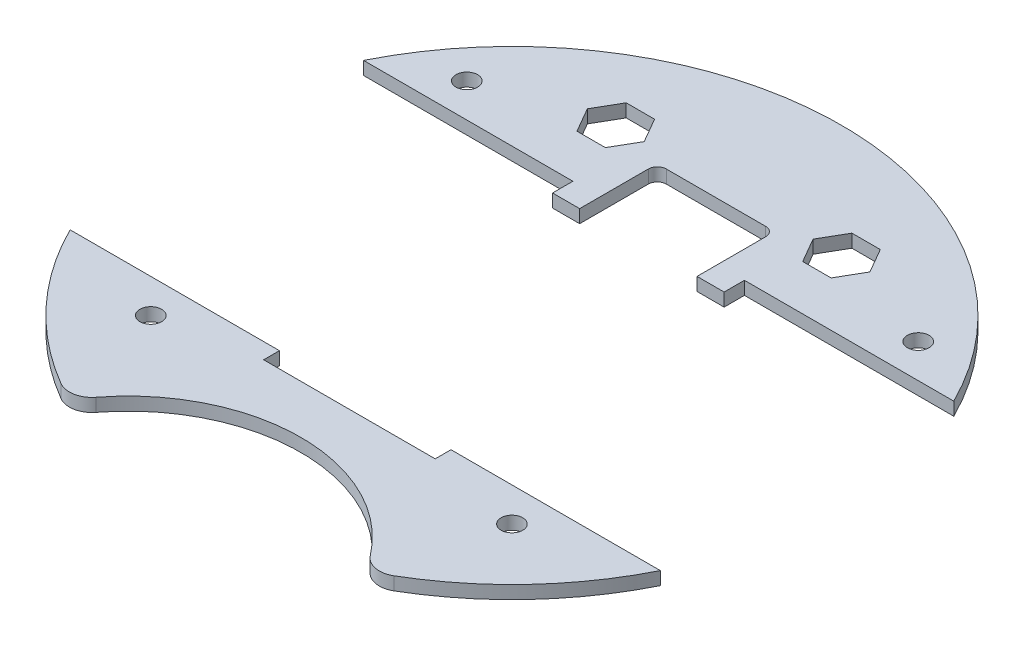
from build123d import *

# Parameters (mm, degrees)
BOSS_EXTRUDE1_DEPTH  = 2.9
SOLENOID_PLACEMENT_W = 38
SOLENOID_PLACEMENT_H = 64
CUT_EXTRUDE1_DEPTH   = 104.278313309
CUT_EXTRUDE4_DEPTH   = 104.278313309
CUT_EXTRUDE5_DEPTH   = 104.278313309
SKETCH6_R            = 2.4
CUT_EXTRUDE6_DEPTH   = 104.278313309
CUT_EXTRUDE3_DEPTH   = 104.278313309


with BuildPart() as part:
    # Sketch1 → Boss-Extrude1 (new body)
    with BuildSketch(Plane(origin=(0, 0, 0), x_dir=(1, 0, 0), z_dir=(0, 1, 0))):
        with BuildLine():
            ThreePointArc((36.856602833, -63.012624351), (0, 73), (-36.856602833, -63.012624351))
            ThreePointArc((-36.856602833, -63.012624351), (-33.368752207, -63.602994345), (-30.363140064, -61.737536127))
            ThreePointArc((-30.363140064, -61.737536127), (0, -46.75), (30.363140064, -61.737536127))
            ThreePointArc((30.363140064, -61.737536127), (33.368752207, -63.602994345), (36.856602833, -63.012624351))
        make_face()
    extrude(amount=BOSS_EXTRUDE1_DEPTH)

    # solenoid placement → Cut-Extrude1 (cut, through all)
    with BuildSketch(Plane(origin=(0, 2.9, 0), x_dir=(1, 0, 0), z_dir=(0, 1, 0))):
        with Locations((0, -4)):
            Rectangle(SOLENOID_PLACEMENT_W, SOLENOID_PLACEMENT_H)
    extrude(amount=-CUT_EXTRUDE1_DEPTH, mode=Mode.SUBTRACT)

    # Sketch4 → Cut-Extrude4 (cut, through all)
    with BuildSketch(Plane(origin=(0, 2.9, 0), x_dir=(1, 0, 0), z_dir=(0, 1, 0))):
        with BuildLine():
            Line((-13, 28), (13, 28))
            Line((13, 28), (13, 43.2))
            ThreePointArc((13, 43.2), (12.414213562, 44.614213562), (11, 45.2))
            Line((11, 45.2), (-11, 45.2))
            ThreePointArc((-11, 45.2), (-12.414213562, 44.614213562), (-13, 43.2))
            Line((-13, 43.2), (-13, 28))
        make_face()
    extrude(amount=-CUT_EXTRUDE4_DEPTH, mode=Mode.SUBTRACT)

    # Sketch5 → Cut-Extrude5 (cut, through all)
    with BuildSketch(Plane(origin=(0, 2.9, 0), x_dir=(1, 0, 0), z_dir=(0, 1, 0))):
        Polygon((-18.706882066, 48), (-21.853441033, 53.45), (-28.146558967, 53.45), (-31.293117934, 48), (-28.146558967, 42.55), (-21.853441033, 42.55), align=None)
        Polygon((18.706882066, 48), (21.853441033, 42.55), (28.146558967, 42.55), (31.293117934, 48), (28.146558967, 53.45), (21.853441033, 53.45), align=None)
    extrude(amount=-CUT_EXTRUDE5_DEPTH, mode=Mode.SUBTRACT)

    # Sketch6 → Cut-Extrude6 (cut, through all)
    with BuildSketch(Plane(origin=(0, 2.9, 0), x_dir=(1, 0, 0), z_dir=(0, 1, 0))):
        with Locations((40, -40)):
            Circle(SKETCH6_R)
        with Locations((-40, -40)):
            Circle(SKETCH6_R)
        with Locations((-50, 40)):
            Circle(SKETCH6_R)
        with Locations((50, 40)):
            Circle(SKETCH6_R)
    extrude(amount=-CUT_EXTRUDE6_DEPTH, mode=Mode.SUBTRACT)

    # Sketch3 → Cut-Extrude3 (cut, through all)
    with BuildSketch(Plane(origin=(0, 2.9, 0), x_dir=(1, 0, 0), z_dir=(0, 1, 0))):
        Polygon((-19, 28), (-19, 32.5), (-73, 32.5), (-73, -32.5), (73, -32.5), (73, 32.5), (19, 32.5), (19, 28), align=None)
    extrude(amount=-CUT_EXTRUDE3_DEPTH, mode=Mode.SUBTRACT)


with BuildPart() as cut_extrude3_piece_1:
    # of the separate pieces the step leaves, piece 1, a body of its own (cut_extrude3_pieces)
    add(part.part.solids().sort_by_distance((65.366275709, 0, -32.5))[0])


with BuildPart() as cut_extrude3_piece_2:
    # of the separate pieces the step leaves, piece 2, a body of its own (cut_extrude3_pieces)
    add(part.part.solids().sort_by_distance((-36.856602833, 0, 63.012624351))[0])


solid = Compound([cut_extrude3_piece_1.part, cut_extrude3_piece_2.part])
